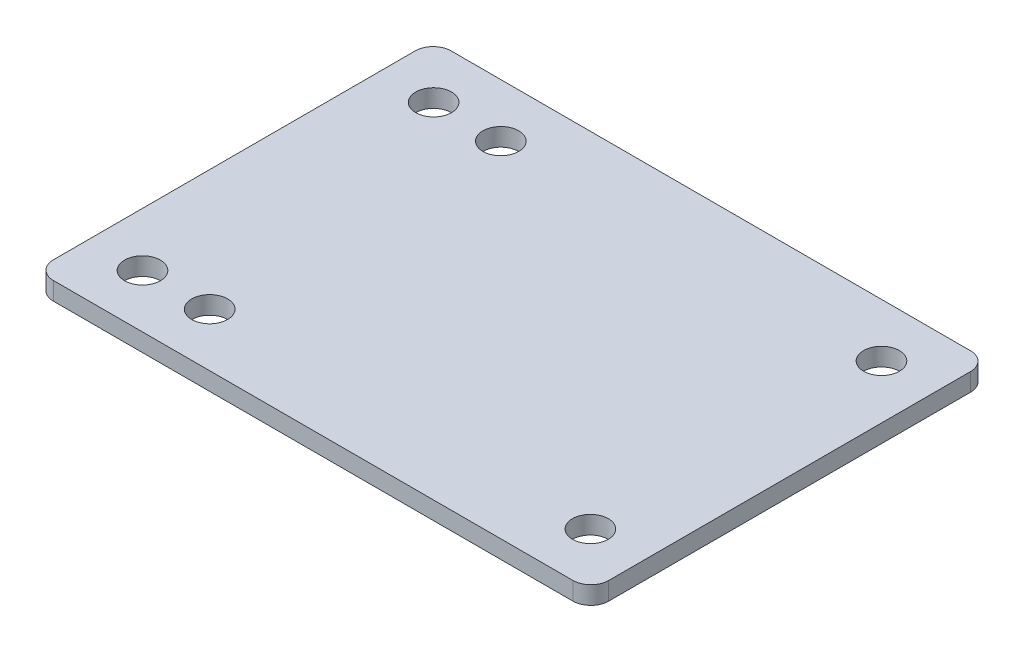
from build123d import *

# Parameters (mm, degrees)
SKETCH1_W           = 78.74
SKETCH1_H           = 56.388
BOSS_EXTRUDE1_DEPTH = 2.54
FILLET1_R           = 2.54
SKETCH2_R           = 2.54
CUT_EXTRUDE1_DEPTH  = 2.54


with BuildPart() as part:
    # Sketch1 → Boss-Extrude1 (new body)
    with BuildSketch(Plane(origin=(0, 0, 0), x_dir=(1, 0, 0), z_dir=(0, 1, 0))):
        Rectangle(SKETCH1_W, SKETCH1_H)
    extrude(amount=BOSS_EXTRUDE1_DEPTH)

    # Fillet1
    fillet1_edges = [part.edges().sort_by_distance(p)[0] for p in [
        (39.37, 1.27, -28.194),
        (39.37, 1.27, 28.194),
        (-39.37, 1.27, -28.194),
        (-39.37, 1.27, 28.194),
    ]]
    fillet(fillet1_edges, radius=FILLET1_R)

    # Sketch2 → Cut-Extrude1 (cut)
    with BuildSketch(Plane(origin=(0, 2.54, 0), x_dir=(1, 0, 0), z_dir=(0, 1, 0))):
        with Locations((31.75, 20.6375)):
            Circle(SKETCH2_R)
        with Locations((31.75, -20.6375)):
            Circle(SKETCH2_R)
        with Locations((-31.75, -20.6375)):
            Circle(SKETCH2_R)
        with Locations((-31.75, 20.6375)):
            Circle(SKETCH2_R)
        with Locations((-22.225, -20.6375)):
            Circle(SKETCH2_R)
        with Locations((-22.225, 20.6375)):
            Circle(SKETCH2_R)
    extrude(amount=-CUT_EXTRUDE1_DEPTH, mode=Mode.SUBTRACT)


solid = part.part
